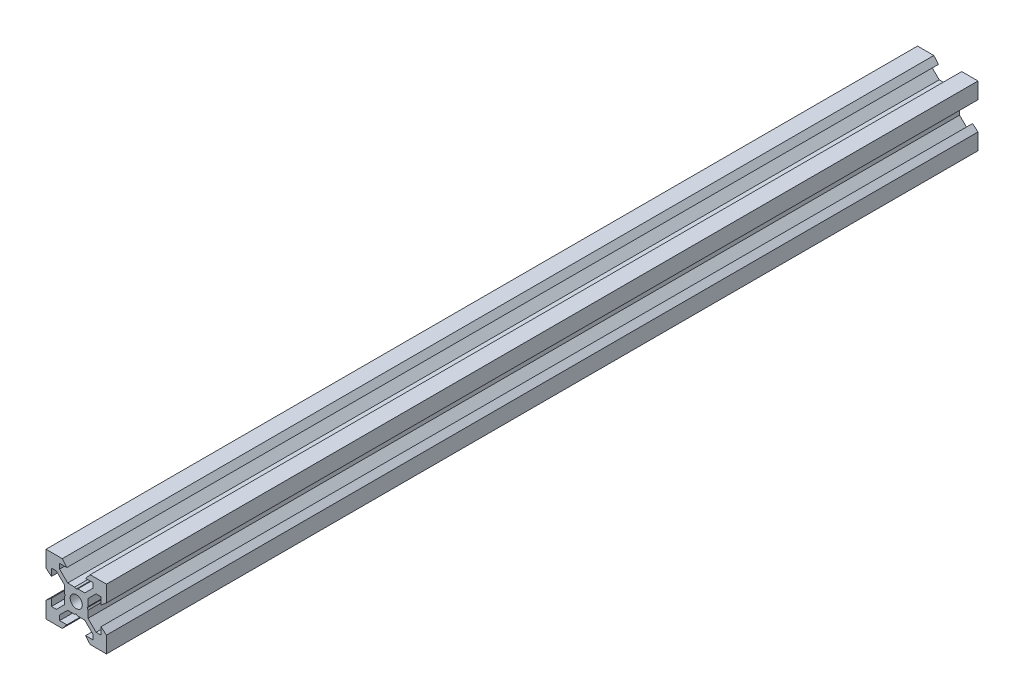
from build123d import *

# Parameters (mm, degrees)
SKETCH1_R           = 2
BOSS_EXTRUDE1_DEPTH = 144.165


with BuildPart() as part:
    # Sketch1 → Boss-Extrude1 (new, symmetric)
    with BuildSketch(Plane.XY):
        Polygon((10, 4.610379336), (10, 10), (4.610379336, 10), (3.1, 8.2), (5.5, 8.2), (5.5, 6.560660172), (2.839339828, 3.9), (0.519615242, 3.9), (0, 3.6), (-0.519615242, 3.9), (-2.839339828, 3.9), (-5.5, 6.560660172), (-5.5, 8.2), (-3.1, 8.2), (-4.610379336, 10), (-10, 10), (-10, 4.610379336), (-8.2, 3.1), (-8.2, 5.5), (-6.560660172, 5.5), (-3.9, 2.839339828), (-3.9, 0.519615242), (-3.6, 0), (-3.9, -0.519615242), (-3.9, -2.839339828), (-6.560660172, -5.5), (-8.2, -5.5), (-8.2, -3.1), (-10, -4.610379336), (-10, -10), (-4.610379336, -10), (-3.1, -8.2), (-5.5, -8.2), (-5.5, -6.560660172), (-2.839339828, -3.9), (-0.519615242, -3.9), (0, -3.6), (0.519615242, -3.9), (2.839339828, -3.9), (5.5, -6.560660172), (5.5, -8.2), (3.1, -8.2), (4.610379336, -10), (10, -10), (10, -4.610379336), (8.2, -3.1), (8.2, -5.5), (6.560660172, -5.5), (3.9, -2.839339828), (3.9, -0.519615242), (3.6, 0), (3.9, 0.519615242), (3.9, 2.839339828), (6.560660172, 5.5), (8.2, 5.5), (8.2, 3.1), align=None)
        Circle(SKETCH1_R, mode=Mode.SUBTRACT)
    extrude(amount=BOSS_EXTRUDE1_DEPTH, both=True)


solid = part.part
